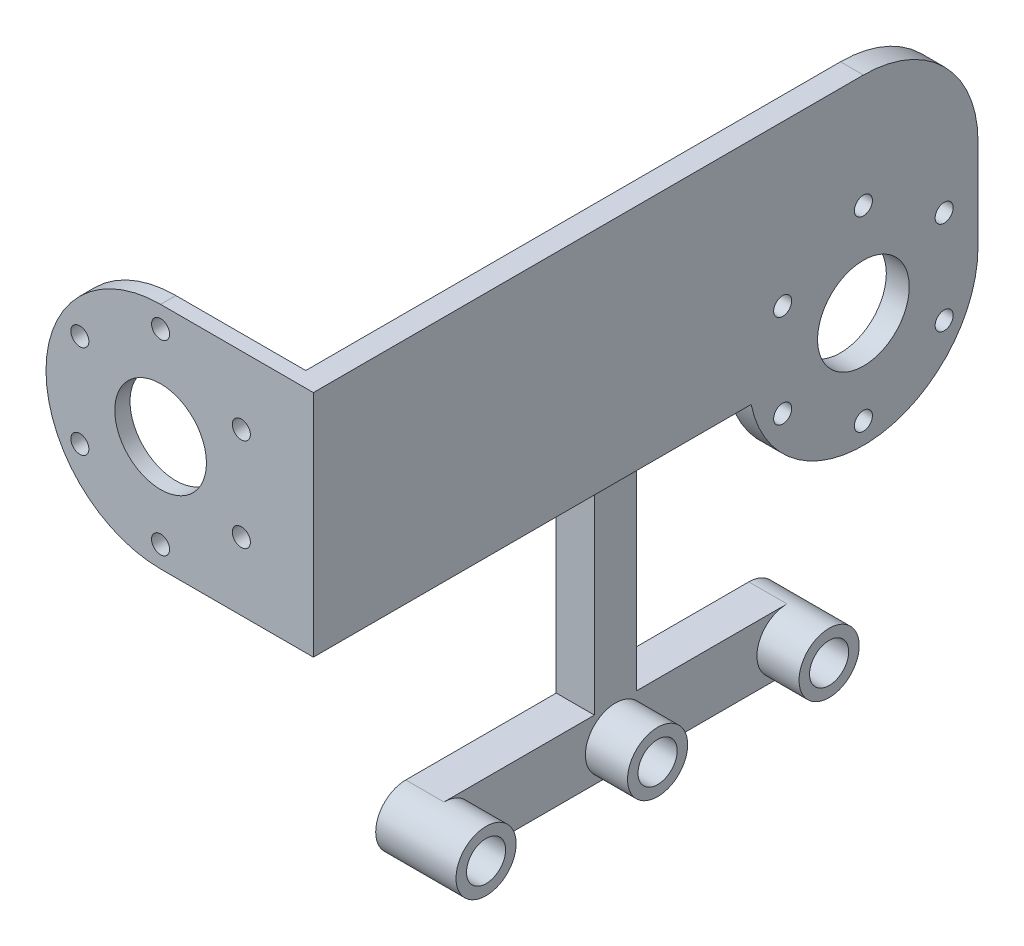
from build123d import *
from build123d.topology import SkipClean

# Parameters (mm, degrees)
SKETCH1_W           = 50.8
SKETCH1_H           = 38.1
SKETCH1_R           = 1.5
SKETCH1_R_2         = 7.62
BOSS_EXTRUDE1_DEPTH = 2.54
CUT_EXTRUDE1_REACH  = 33.851
SKETCH4_R           = 19.05
SKETCH4_W           = 91.44
SKETCH4_H           = 38.1
SKETCH4_W_2         = 38.1
SKETCH4_H_2         = 15.24
BOSS_EXTRUDE2_DEPTH = 3.81
CUT_EXTRUDE2_REACH  = 123.675
SKETCH5_R           = 7.62
SKETCH5_R_2         = 1.5
SKETCH6_W           = 19.05
SKETCH6_H           = 7
BOSS_EXTRUDE3_DEPTH = 6.35
SKETCH9_R           = 3.25
BOSS_EXTRUDE6_DEPTH = 6.35
SKETCH10_R          = 5
SKETCH10_R_2        = 3.25
BOSS_EXTRUDE7_DEPTH = 7


with BuildPart() as part:
    # Sketch1 → Boss-Extrude1 (new body)
    with BuildSketch(Plane.XY):
        Rectangle(SKETCH1_W, SKETCH1_H)
        with Locations((0, 15.5)):
            Circle(SKETCH1_R, mode=Mode.SUBTRACT)
        with Locations((13.423393759, 7.75)):
            Circle(SKETCH1_R, mode=Mode.SUBTRACT)
        with Locations((13.423393759, -7.75)):
            Circle(SKETCH1_R, mode=Mode.SUBTRACT)
        with Locations((0, -15.5)):
            Circle(SKETCH1_R, mode=Mode.SUBTRACT)
        with Locations((-13.423393759, -7.75)):
            Circle(SKETCH1_R, mode=Mode.SUBTRACT)
        with Locations((-13.423393759, 7.75)):
            Circle(SKETCH1_R, mode=Mode.SUBTRACT)
        Circle(SKETCH1_R_2, mode=Mode.SUBTRACT)
    extrude(amount=BOSS_EXTRUDE1_DEPTH)

    # Sketch2 → Cut-Extrude1 (cut, up to next)
    with BuildSketch(Plane.XY.offset(2.54), mode=Mode.PRIVATE) as cut_extrude1_sk1:
        with BuildLine():
            Line((0, 19.05), (-25.4, 19.05))
            Line((-25.4, 19.05), (-25.4, -19.05))
            Line((-25.4, -19.05), (0, -19.05))
            ThreePointArc((0, -19.05), (-19.05, 0), (0, 19.05))
        make_face()
    cut_extrude1_tool1 = extrude(cut_extrude1_sk1.sketch, amount=-CUT_EXTRUDE1_REACH, mode=Mode.PRIVATE) & part.part
    add(cut_extrude1_tool1.solids().sort_by_distance((-19.314937, 0, 2.54))[0], mode=Mode.SUBTRACT)

    # Sketch4 → Boss-Extrude2 (add)
    with BuildSketch(Plane(origin=(25.4, 0, 0), x_dir=(0, 0, -1), z_dir=(1, 0, 0))):
        with Locations((88.9, 0)):
            Circle(SKETCH4_R)
        with Locations((88.9, -15.24)):
            Circle(SKETCH4_R)
        with Locations((43.18, 0)):
            Rectangle(SKETCH4_W, SKETCH4_H)
        with Locations((88.9, -7.62)):
            Rectangle(SKETCH4_W_2, SKETCH4_H_2)
    extrude(amount=-BOSS_EXTRUDE2_DEPTH)

    # Sketch5 → Cut-Extrude2 (cut, up to next)
    with BuildSketch(Plane(origin=(25.4, 0, 0), x_dir=(0, 0, -1), z_dir=(1, 0, 0)), mode=Mode.PRIVATE) as cut_extrude2_sk1:
        with Locations((88.9, -15.24)):
            Circle(SKETCH5_R)
    cut_extrude2_tool1 = extrude(cut_extrude2_sk1.sketch, amount=-CUT_EXTRUDE2_REACH, mode=Mode.PRIVATE) & part.part
    # Sketch5 → Cut-Extrude2 (cut, up to next)
    with BuildSketch(Plane(origin=(25.4, 0, 0), x_dir=(0, 0, -1), z_dir=(1, 0, 0)), mode=Mode.PRIVATE) as cut_extrude2_sk2:
        with Locations((88.9, 0.26)):
            Circle(SKETCH5_R_2)
    cut_extrude2_tool2 = extrude(cut_extrude2_sk2.sketch, amount=-CUT_EXTRUDE2_REACH, mode=Mode.PRIVATE) & part.part
    # Sketch5 → Cut-Extrude2 (cut, up to next)
    with BuildSketch(Plane(origin=(25.4, 0, 0), x_dir=(0, 0, -1), z_dir=(1, 0, 0)), mode=Mode.PRIVATE) as cut_extrude2_sk3:
        with Locations((102.323393759, -7.49)):
            Circle(SKETCH5_R_2)
    cut_extrude2_tool3 = extrude(cut_extrude2_sk3.sketch, amount=-CUT_EXTRUDE2_REACH, mode=Mode.PRIVATE) & part.part
    # Sketch5 → Cut-Extrude2 (cut, up to next)
    with BuildSketch(Plane(origin=(25.4, 0, 0), x_dir=(0, 0, -1), z_dir=(1, 0, 0)), mode=Mode.PRIVATE) as cut_extrude2_sk4:
        with Locations((102.323393759, -22.99)):
            Circle(SKETCH5_R_2)
    cut_extrude2_tool4 = extrude(cut_extrude2_sk4.sketch, amount=-CUT_EXTRUDE2_REACH, mode=Mode.PRIVATE) & part.part
    # Sketch5 → Cut-Extrude2 (cut, up to next)
    with BuildSketch(Plane(origin=(25.4, 0, 0), x_dir=(0, 0, -1), z_dir=(1, 0, 0)), mode=Mode.PRIVATE) as cut_extrude2_sk5:
        with Locations((88.9, -30.74)):
            Circle(SKETCH5_R_2)
    cut_extrude2_tool5 = extrude(cut_extrude2_sk5.sketch, amount=-CUT_EXTRUDE2_REACH, mode=Mode.PRIVATE) & part.part
    # Sketch5 → Cut-Extrude2 (cut, up to next)
    with BuildSketch(Plane(origin=(25.4, 0, 0), x_dir=(0, 0, -1), z_dir=(1, 0, 0)), mode=Mode.PRIVATE) as cut_extrude2_sk6:
        with Locations((75.476606241, -22.99)):
            Circle(SKETCH5_R_2)
    cut_extrude2_tool6 = extrude(cut_extrude2_sk6.sketch, amount=-CUT_EXTRUDE2_REACH, mode=Mode.PRIVATE) & part.part
    # Sketch5 → Cut-Extrude2 (cut, up to next)
    with BuildSketch(Plane(origin=(25.4, 0, 0), x_dir=(0, 0, -1), z_dir=(1, 0, 0)), mode=Mode.PRIVATE) as cut_extrude2_sk7:
        with Locations((75.476606241, -7.49)):
            Circle(SKETCH5_R_2)
    cut_extrude2_tool7 = extrude(cut_extrude2_sk7.sketch, amount=-CUT_EXTRUDE2_REACH, mode=Mode.PRIVATE) & part.part
    add(cut_extrude2_tool1.solids().sort_by_distance((25.4, -15.24, -88.9))[0], mode=Mode.SUBTRACT)
    add(cut_extrude2_tool2.solids().sort_by_distance((25.4, 0.26, -88.9))[0], mode=Mode.SUBTRACT)
    add(cut_extrude2_tool3.solids().sort_by_distance((25.4, -7.49, -102.323394))[0], mode=Mode.SUBTRACT)
    add(cut_extrude2_tool4.solids().sort_by_distance((25.4, -22.99, -102.323394))[0], mode=Mode.SUBTRACT)
    add(cut_extrude2_tool5.solids().sort_by_distance((25.4, -30.74, -88.9))[0], mode=Mode.SUBTRACT)
    add(cut_extrude2_tool6.solids().sort_by_distance((25.4, -22.99, -75.476606))[0], mode=Mode.SUBTRACT)
    add(cut_extrude2_tool7.solids().sort_by_distance((25.4, -7.49, -75.476606))[0], mode=Mode.SUBTRACT)

    # Sketch6 → Boss-Extrude3 (add)
    with BuildSketch(Plane.XZ.offset(19.05)):
        with Locations((15.875, -60.38488816)):
            Rectangle(SKETCH6_W, SKETCH6_H)
    extrude(amount=-BOSS_EXTRUDE3_DEPTH)

    # Sketch9 → Boss-Extrude6 (add)
    with BuildSketch(Plane.ZY.offset(-6.35)):
        with BuildLine():
            Line((-56.88488816, -19.05), (-63.88488816, -19.05))
            Line((-63.88488816, -19.05), (-63.88488816, -63.45))
            Line((-63.88488816, -63.45), (-88.9, -63.45))
            ThreePointArc((-88.9, -63.45), (-93.9, -68.45), (-88.9, -73.45))
            Line((-88.9, -73.45), (-60.38488816, -73.45))
            Line((-60.38488816, -73.45), (-31.86977632, -73.45))
            ThreePointArc((-31.86977632, -73.45), (-26.86977632, -68.45), (-31.86977632, -63.45))
            Line((-31.86977632, -63.45), (-56.88488816, -63.45))
            Line((-56.88488816, -63.45), (-56.88488816, -19.05))
        make_face()
        with Locations((-88.9, -68.45)):
            Circle(SKETCH9_R, mode=Mode.SUBTRACT)
        with BuildLine():
            ThreePointArc((-57.13488816, -68.45), (-58.086791121, -70.748097039), (-60.38488816, -71.7))
            ThreePointArc((-60.38488816, -71.7), (-63.63488816, -68.45), (-60.38488816, -65.2))
            ThreePointArc((-60.38488816, -65.2), (-58.086791121, -66.151902961), (-57.13488816, -68.45))
        make_face(mode=Mode.SUBTRACT)
        with Locations((-31.86977632, -68.45)):
            Circle(SKETCH9_R, mode=Mode.SUBTRACT)
    extrude(amount=-BOSS_EXTRUDE6_DEPTH)

    # Sketch10 → Boss-Extrude7 (add)
    # profile 1 of 3: a face of its own
    with SkipClean():  # the faces are left unmerged after this step: merging them gives an invalid solid
        with BuildSketch(Plane(origin=(12.7, 0, 0), x_dir=(0, 0, -1), z_dir=(1, 0, 0))):
            with Locations((60.38488816, -68.45)):
                Circle(SKETCH10_R)
            with Locations((60.38488816, -68.45)):
                Circle(SKETCH10_R_2, mode=Mode.SUBTRACT)
        # profile 2 of 3: a face of its own
        with BuildSketch(Plane(origin=(12.7, 0, 0), x_dir=(0, 0, -1), z_dir=(1, 0, 0))):
            with Locations((31.86977632, -68.45)):
                Circle(SKETCH10_R)
            with Locations((31.86977632, -68.45)):
                Circle(SKETCH10_R_2, mode=Mode.SUBTRACT)
        # profile 3 of 3: a face of its own
        with BuildSketch(Plane(origin=(12.7, 0, 0), x_dir=(0, 0, -1), z_dir=(1, 0, 0))):
            with Locations((88.9, -68.45)):
                Circle(SKETCH10_R)
            with Locations((88.9, -68.45)):
                Circle(SKETCH10_R_2, mode=Mode.SUBTRACT)
        extrude(amount=BOSS_EXTRUDE7_DEPTH)


solid = part.part
